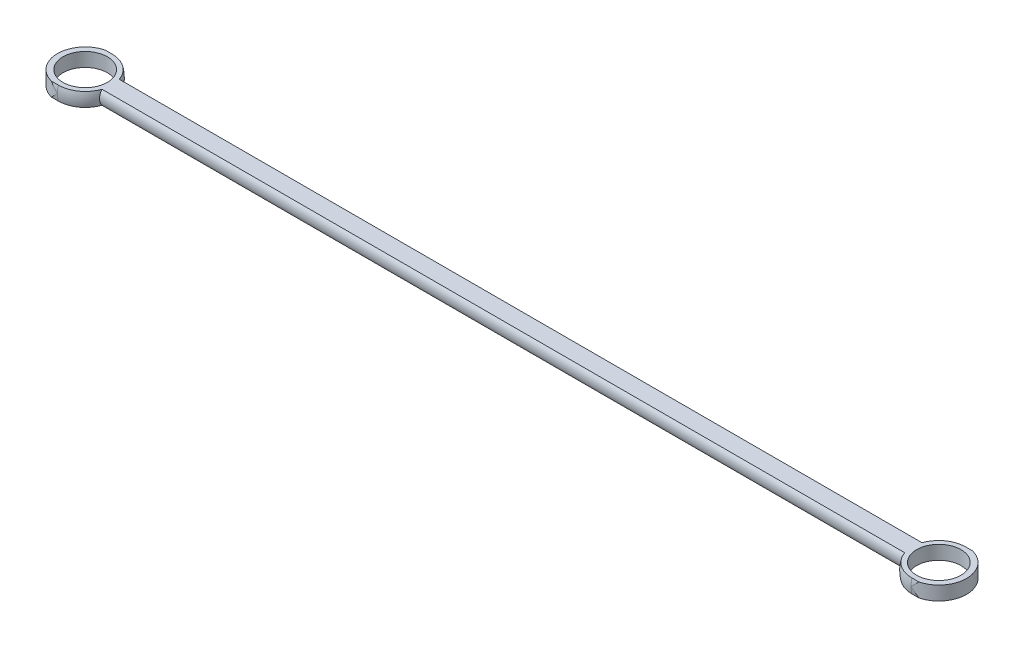
from build123d import *

# Parameters (mm, degrees)
EXTRUDE_1_DEPTH         = 180
CUT_EXTRUDE_START       = -1.25
CUT_EXTRUDE_1_OUTLINE_W = 200.912361756
CUT_EXTRUDE_1_OUTLINE_H = 41.35790762
CUT_EXTRUDE_1_OUTLINE_R = 4
CUT_EXTRUDE_1_DEPTH     = 2.5


# Read off the part's stored shape, not the designer's step: 切除-拉伸1
with BuildPart() as part:
    # 草图2 → 凸台-拉伸1 (new body)
    with BuildSketch(Plane(origin=(0, 0, 0), x_dir=(0, 0, -1), z_dir=(1, 0, 0))):
        with BuildLine():
            Line((4.841229183, 1.25), (0, 1.25))
            Line((0, 1.25), (0, -1.25))
            Line((0, -1.25), (4.841229183, -1.25))
            ThreePointArc((4.841229183, -1.25), (4.960148481, -0.630021462), (5, 0))
            ThreePointArc((5, 0), (4.960148481, 0.630021462), (4.841229183, 1.25))
        make_face()
        with BuildLine():
            Line((0, -1.25), (0, 1.25))
            Line((0, 1.25), (-4.841229183, 1.25))
            ThreePointArc((-4.841229183, 1.25), (-5, 0), (-4.841229183, -1.25))
            Line((-4.841229183, -1.25), (0, -1.25))
        make_face()
    extrude(amount=EXTRUDE_1_DEPTH)

    # 切除-拉伸1 outline → 切除-拉伸1 (cut)
    # profile 1 of 2: a face of its own
    with BuildSketch(Plane(origin=(0, 0, 0), x_dir=(1, 0, 0), z_dir=(0, 1, 0)).offset(CUT_EXTRUDE_START)):
        with Locations((92.35420838, -2.241239646)):
            Rectangle(CUT_EXTRUDE_1_OUTLINE_W, CUT_EXTRUDE_1_OUTLINE_H)
        with BuildLine():
            Line((90, 5), (90, -5))
            Line((90, -5), (13.074176, -5))
            ThreePointArc((13.074176, -5), (8.074176, 0), (13.074176, 5))
            Line((13.074176, 5), (90, 5))
        make_face(mode=Mode.SUBTRACT)
    # profile 2 of 2: a face of its own
    with BuildSketch(Plane(origin=(0, 0, 0), x_dir=(1, 0, 0), z_dir=(0, 1, 0)).offset(CUT_EXTRUDE_START)):
        with Locations((13.074176, 0)):
            Circle(CUT_EXTRUDE_1_OUTLINE_R)
    extrude(amount=CUT_EXTRUDE_1_DEPTH, mode=Mode.SUBTRACT)

    # 草图4 → 切除-旋转3 (revolve, cut)
    with BuildSketch(Plane(origin=(0, 0, 0), x_dir=(1, 0, 0), z_dir=(0, 1, 0))):
        with BuildLine():
            Line((17.656751695, 2), (93.188618098, 2))
            Line((93.188618098, 2), (93.188618098, 5))
            Line((93.188618098, 5), (13.074176, 5))
            ThreePointArc((13.074176, 5), (15.812788788, 4.183300133), (17.656751695, 2))
        make_face()
        with BuildLine():
            Line((93.188618098, -4.841229183), (93.188618098, -2))
            Line((93.188618098, -2), (17.656751695, -2))
            ThreePointArc((17.656751695, -2), (16.318074985, -3.804880993), (14.324176, -4.841229183))
            Line((14.324176, -4.841229183), (93.188618098, -4.841229183))
        make_face()
    revolve(axis=Axis((18.074176, 0, 0), (1, 0, 0)), mode=Mode.SUBTRACT)

    # 镜向1: part across plane


with BuildPart() as part_1:
    add(part.part)
    add(part.part.mirror(Plane(origin=(90, 170, 0), x_dir=(0, 0, 1), z_dir=(1, 0, 0))))


solid = part_1.part
